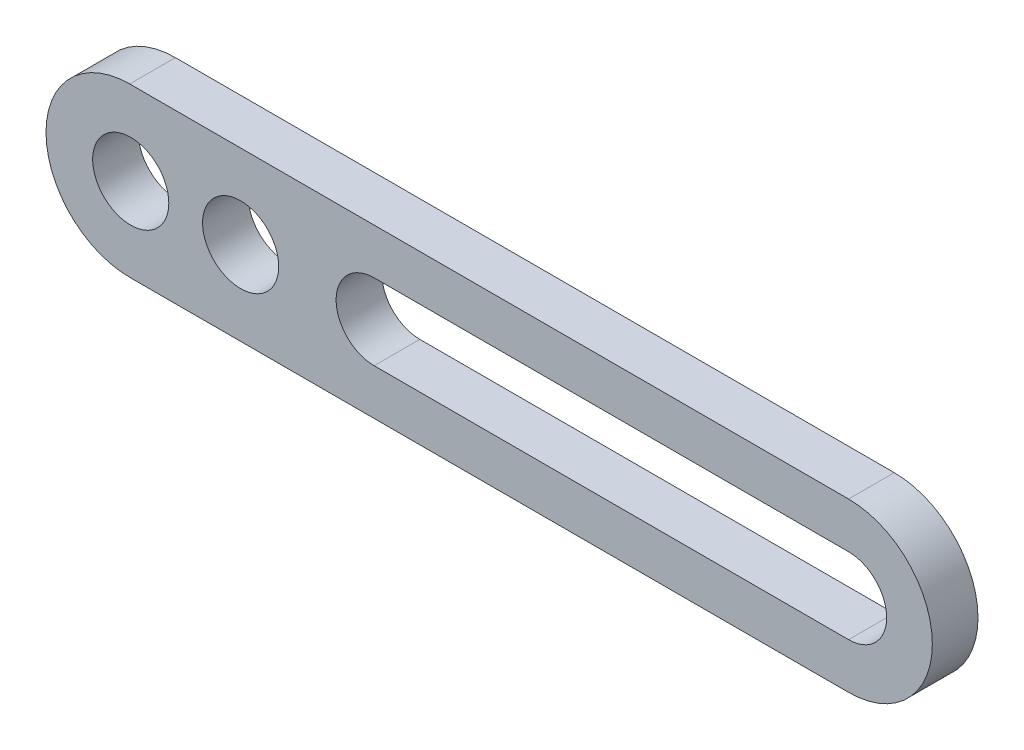
from build123d import *

# Parameters (mm, degrees)
SKETCH2_R           = 2.5
BOSS_EXTRUDE1_DEPTH = 3


with BuildPart() as part:
    # Sketch2 → Boss-Extrude1 (new body)
    with BuildSketch(Plane.XY):
        with BuildLine():
            Line((47.152494721, 6.251108976), (-0.065083432, 6.251108976))
            ThreePointArc((-0.065083432, 6.251108976), (-5.565083432, 0.751108976), (-0.065083432, -4.748891024))
            Line((-0.065083432, -4.748891024), (47.152494721, -4.748891024))
            ThreePointArc((47.152494721, -4.748891024), (52.652494721, 0.751108976), (47.152494721, 6.251108976))
        make_face()
        with Locations((0, 0.751108976)):
            Circle(SKETCH2_R, mode=Mode.SUBTRACT)
        with Locations((7.219090789, 0.751108976)):
            Circle(SKETCH2_R, mode=Mode.SUBTRACT)
        with BuildLine():
            ThreePointArc((15.989577897, -1.748891024), (13.489577897, 0.751108976), (15.989577897, 3.251108976))
            Line((15.989577897, 3.251108976), (47.152494721, 3.251108976))
            ThreePointArc((47.152494721, 3.251108976), (49.652494721, 0.751108976), (47.152494721, -1.748891024))
            Line((47.152494721, -1.748891024), (15.989577897, -1.748891024))
        make_face(mode=Mode.SUBTRACT)
    extrude(amount=BOSS_EXTRUDE1_DEPTH)


solid = part.part
